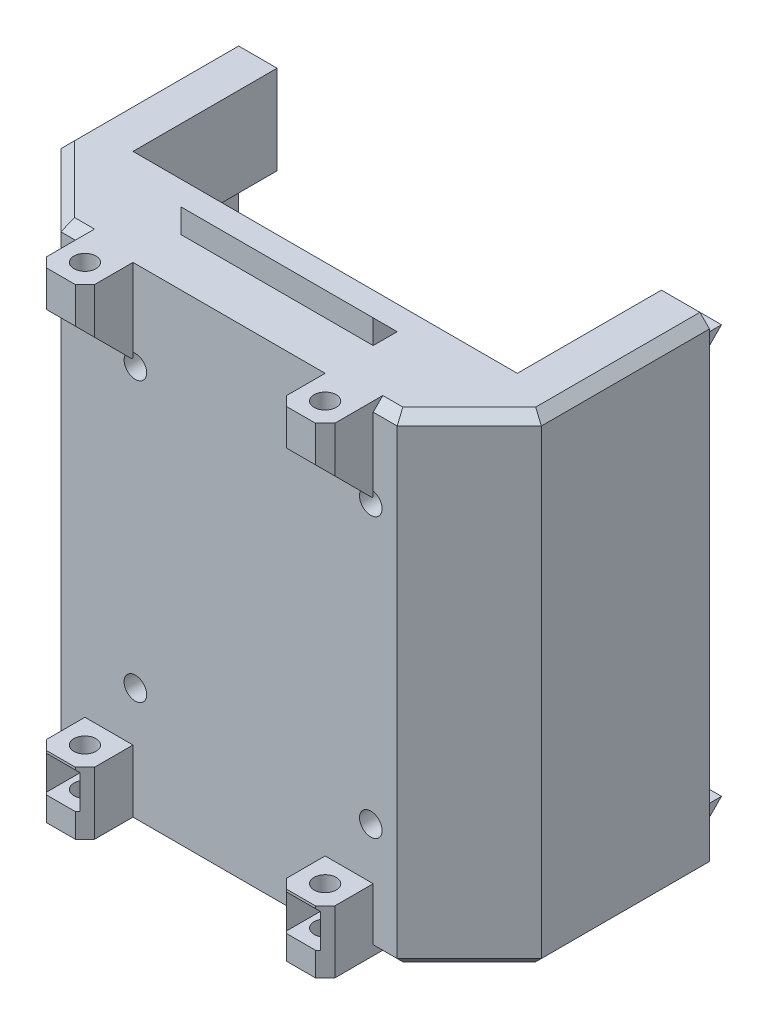
from build123d import *

# Parameters (mm, degrees)
SKETCH1_W               = 100
SKETCH1_H               = 50
BOSS_EXTRUDE1_DEPTH     = 100
CHAMFER1_SIZE           = 15
CUT_EXTRUDE1_REACH      = 124.474
SKETCH2_W               = 80
SKETCH2_H               = 30
SKETCH3_W               = 10
SKETCH3_H               = 10
SKETCH3_R               = 2.3
BOSS_EXTRUDE2_DEPTH     = 7.5
BOSS_EXTRUDE3_START     = -87
SKETCH3_2_W             = 10
SKETCH3_2_H             = 10
SKETCH3_2_R             = 2.3
BOSS_EXTRUDE3_DEPTH     = 13
SKETCH4_W               = 7
SKETCH4_H               = 3.5
CUT_EXTRUDE2_DEPTH      = 9
CHAMFER2_SIZE           = 4
CHAMFER3_SIZE           = 10
CUT_EXTRUDE3_REACH      = 131.474
CUT_EXTRUDE3_START      = -7
SKETCH5_R               = 3.55
SKETCH6_W               = 40
SKETCH6_H               = 5
BOSS_EXTRUDE4_DEPTH     = 5
CHAMFER4_SIZE           = 5
CUT_EXTRUDE4_START      = -100
SKETCH6_2_W             = 40
SKETCH6_2_H             = 5
CUT_EXTRUDE4_DEPTH      = 5
CHAMFER5_SIZE           = 4.75
SKETCH7_W               = 5
SKETCH7_H               = 5
CUT_EXTRUDE5_DEPTH      = 5
SKETCH8_W               = 5
SKETCH8_H               = 5
BOSS_EXTRUDE5_DEPTH     = 5
CHAMFER6_SIZE           = 5
CHAMFER7_SIZE           = 4.75
CHAMFER8_SIZE           = 2
CHAMFER9_SIZE           = 2
CUT_EXTRUDE6_REACH      = 123.45
SKETCH9_R               = 1.35
CUT_EXTRUDE7_DEPTH      = 30
CUT_EXTRUDE_THIN1_START = -15
SKETCH9_2_R             = 2.35
SKETCH9_2_R_2           = 1.35
CUT_EXTRUDE_THIN1_DEPTH = 5


# Some blends are built 0.0001 mm under size
with BuildPart() as part:
    # Sketch1 → Boss-Extrude1 (new body)
    with BuildSketch(Plane(origin=(0, 0, 0), x_dir=(1, 0, 0), z_dir=(0, 1, 0))):
        with Locations((0, 25)):
            Rectangle(SKETCH1_W, SKETCH1_H)
    extrude(amount=BOSS_EXTRUDE1_DEPTH)

    # Chamfer1
    chamfer1_edges = [part.edges().sort_by_distance(p)[0] for p in [
        (50, 50, 0),
        (-50, 50, 0),
    ]]
    chamfer(chamfer1_edges, length=CHAMFER1_SIZE)

    # Sketch2 → Cut-Extrude1 (cut, up to next)
    with BuildSketch(Plane(origin=(0, 100, 0), x_dir=(1, 0, 0), z_dir=(0, 1, 0)), mode=Mode.PRIVATE) as cut_extrude1_sk1:
        with Locations((0, 35)):
            Rectangle(SKETCH2_W, SKETCH2_H)
    cut_extrude1_tool1 = extrude(cut_extrude1_sk1.sketch, amount=-CUT_EXTRUDE1_REACH, mode=Mode.PRIVATE) & part.part
    add(cut_extrude1_tool1.solids().sort_by_distance((0, 100, -35))[0], mode=Mode.SUBTRACT)

    # Sketch3 → Boss-Extrude2 (add)
    # profile 1 of 2: a face of its own
    with BuildSketch(Plane(origin=(0, 100, 0), x_dir=(1, 0, 0), z_dir=(0, 1, 0))):
        with Locations((25, -5)):
            Rectangle(SKETCH3_W, SKETCH3_H)
        with Locations(Location((25, -5, 0), (0, 0, 270))):
            Circle(SKETCH3_R, mode=Mode.SUBTRACT)
    # profile 2 of 2: a face of its own
    with BuildSketch(Plane(origin=(0, 100, 0), x_dir=(1, 0, 0), z_dir=(0, 1, 0))):
        with Locations((-25, -5)):
            Rectangle(SKETCH3_W, SKETCH3_H)
        with Locations(Location((-25, -5, 0), (0, 0, 270))):
            Circle(SKETCH3_R, mode=Mode.SUBTRACT)
    extrude(amount=-BOSS_EXTRUDE2_DEPTH)

    # Sketch3<2> → Boss-Extrude3 (add)
    # profile 1 of 2: a face of its own
    with BuildSketch(Plane(origin=(0, 100, 0), x_dir=(1, 0, 0), z_dir=(0, 1, 0)).offset(BOSS_EXTRUDE3_START)):
        with Locations((25, -5)):
            Rectangle(SKETCH3_2_W, SKETCH3_2_H)
        with Locations(Location((25, -5, 0), (0, 0, 270))):
            Circle(SKETCH3_2_R, mode=Mode.SUBTRACT)
    # profile 2 of 2: a face of its own
    with BuildSketch(Plane(origin=(0, 100, 0), x_dir=(1, 0, 0), z_dir=(0, 1, 0)).offset(BOSS_EXTRUDE3_START)):
        with Locations((-25, -5)):
            Rectangle(SKETCH3_2_W, SKETCH3_2_H)
        with Locations(Location((-25, -5, 0), (0, 0, 270))):
            Circle(SKETCH3_2_R, mode=Mode.SUBTRACT)
    extrude(amount=-BOSS_EXTRUDE3_DEPTH)

    # Sketch4 → Cut-Extrude2 (cut)
    with BuildSketch(Plane.XY.offset(10)):
        with Locations((25, 6.75)):
            Rectangle(SKETCH4_W, SKETCH4_H)
        with Locations((-25, 6.75)):
            Rectangle(SKETCH4_W, SKETCH4_H)
    extrude(amount=-CUT_EXTRUDE2_DEPTH, mode=Mode.SUBTRACT)

    # Chamfer2
    # the kernel refuses this chamfer: 4 mm, written as the material it takes off along each edge
    with BuildSketch(Plane(origin=(28.5, 8.5, 10), x_dir=(0, 0.9996219169112968, 0.02749587661058735), z_dir=(-1, 0, 0)), Plane(origin=(-21.5, 8.5, 10), x_dir=(0, 0.9996219169112968, 0.027495876610588214), z_dir=(-1, 0, 0))) as chamfer2_piece_1:
        Polygon((CHAMFER2_SIZE * 0.999621916911, CHAMFER2_SIZE * 0.0274958766106), (-CHAMFER2_SIZE * 0.0274958766106, CHAMFER2_SIZE * 0.999621916911), (0, 0), align=None)
    extrude(amount=7, mode=Mode.SUBTRACT)

    # Chamfer3
    # the kernel refuses this chamfer: 10 mm, written as the material it adds along each edge
    with BuildSketch(Plane(origin=(30, 92.5, 0), x_dir=(0, -0.9996219169112968, -0.027495876610587645), z_dir=(-1, 0, 0))) as chamfer3_piece_1_section:
        Polygon((CHAMFER3_SIZE * 0.999621916911, CHAMFER3_SIZE * 0.0274958766106), (-CHAMFER3_SIZE * 0.0274958766106, CHAMFER3_SIZE * 0.999621916911), (0, 0), align=None)
    chamfer3_piece_1 = extrude(amount=10, mode=Mode.PRIVATE)
    chamfer3_piece_1 = split(chamfer3_piece_1, bisect_by=Plane(origin=(28.657738018, 91.498258794, 10), z_dir=(0, 0, -1)), keep=Keep.TOP, mode=Mode.PRIVATE)
    chamfer3_piece_1 = chamfer3_piece_1 - Plane(origin=(25, 91.498258794, 5), x_dir=(0, 0, 1), z_dir=(0, 1, 0)) * Cylinder(2.3, 60, mode=Mode.PRIVATE)
    add(chamfer3_piece_1)
    with BuildSketch(Plane(origin=(-30, 92.5, 0), x_dir=(0, -0.9996219169112968, -0.02749587661058646), z_dir=(1, 0, 0))) as chamfer3_piece_2_section:
        Polygon((CHAMFER3_SIZE * 0.999621916911, -CHAMFER3_SIZE * 0.0274958766106), (-CHAMFER3_SIZE * 0.0274958766106, -CHAMFER3_SIZE * 0.999621916911), (0, 0), align=None)
    chamfer3_piece_2 = extrude(amount=10, mode=Mode.PRIVATE)
    chamfer3_piece_2 = split(chamfer3_piece_2, bisect_by=Plane(origin=(-28.657738018, 91.498258794, 10), z_dir=(0, 0, -1)), keep=Keep.TOP, mode=Mode.PRIVATE)
    chamfer3_piece_2 = chamfer3_piece_2 - Plane(origin=(-25, 91.498258794, 5), x_dir=(0, 0, 1), z_dir=(0, 1, 0)) * Cylinder(2.3, 60, mode=Mode.PRIVATE)
    add(chamfer3_piece_2)

    # Cut-Extrude3: up to this plane
    cut_extrude3_end = Plane(origin=(-50, 82.5, 0), z_dir=(0, -0.707106781186547, 0.707106781186548))
    # Sketch5 → Cut-Extrude3 (cut, up to the surface)
    with BuildSketch(Plane(origin=(0, 100, 0), x_dir=(1, 0, 0), z_dir=(0, 1, 0)).offset(CUT_EXTRUDE3_START), mode=Mode.PRIVATE) as cut_extrude3_sk1:
        with Locations(Location((-25, -5, 0), (0, 0, 270))):
            Circle(SKETCH5_R)
    cut_extrude3_tool1 = split(extrude(cut_extrude3_sk1.sketch, amount=-CUT_EXTRUDE3_REACH, mode=Mode.PRIVATE), bisect_by=cut_extrude3_end, keep=Keep.BOTH, mode=Mode.PRIVATE)
    add(cut_extrude3_tool1.solids().sort_by_distance((-25, 93, 5))[0], mode=Mode.SUBTRACT)
    # Sketch5 → Cut-Extrude3 (cut, up to the surface)
    with BuildSketch(Plane(origin=(0, 100, 0), x_dir=(1, 0, 0), z_dir=(0, 1, 0)).offset(CUT_EXTRUDE3_START), mode=Mode.PRIVATE) as cut_extrude3_sk2:
        with Locations(Location((25, -5, 0), (0, 0, 270))):
            Circle(SKETCH5_R)
    cut_extrude3_tool2 = split(extrude(cut_extrude3_sk2.sketch, amount=-CUT_EXTRUDE3_REACH, mode=Mode.PRIVATE), bisect_by=cut_extrude3_end, keep=Keep.BOTH, mode=Mode.PRIVATE)
    add(cut_extrude3_tool2.solids().sort_by_distance((25, 93, 5))[0], mode=Mode.SUBTRACT)

    # Sketch6 → Boss-Extrude4 (add)
    with BuildSketch(Plane(origin=(0, 100, 0), x_dir=(1, 0, 0), z_dir=(0, 1, 0))):
        with Locations((0, 12.5)):
            Rectangle(SKETCH6_W, SKETCH6_H)
    extrude(amount=BOSS_EXTRUDE4_DEPTH)

    # Chamfer4
    chamfer4_edges = [part.edges().sort_by_distance(p)[0] for p in [
        (0, 105, -15),
    ]]
    chamfer(chamfer4_edges, length=CHAMFER4_SIZE - 0.0001)  # a hair under: the kernel refuses the full size

    # Sketch6<2> → Cut-Extrude4 (cut)
    with BuildSketch(Plane(origin=(0, 100, 0), x_dir=(1, 0, 0), z_dir=(0, 1, 0)).offset(CUT_EXTRUDE4_START)):
        with Locations((0, 12.5)):
            Rectangle(SKETCH6_2_W, SKETCH6_2_H)
    extrude(amount=CUT_EXTRUDE4_DEPTH, mode=Mode.SUBTRACT)

    # Chamfer5
    chamfer5_edges = [part.edges().sort_by_distance(p)[0] for p in [
        (0, 5, -15),
    ]]
    chamfer(chamfer5_edges, length=CHAMFER5_SIZE)

    # Sketch7 → Cut-Extrude5 (cut)
    with BuildSketch(Plane(origin=(0, 0, -50), x_dir=(-1, 0, 0), z_dir=(0, 0, -1))):
        with Locations((45, 7.5)):
            Rectangle(SKETCH7_W, SKETCH7_H)
        with Locations((45, 92.5)):
            Rectangle(SKETCH7_W, SKETCH7_H)
    extrude(amount=-CUT_EXTRUDE5_DEPTH, mode=Mode.SUBTRACT)

    # Sketch8 → Boss-Extrude5 (add)
    with BuildSketch(Plane(origin=(0, 0, -50), x_dir=(-1, 0, 0), z_dir=(0, 0, -1))):
        with Locations((-45, 92.5)):
            Rectangle(SKETCH8_W, SKETCH8_H)
        with Locations((-45, 7.5)):
            Rectangle(SKETCH8_W, SKETCH8_H)
    extrude(amount=BOSS_EXTRUDE5_DEPTH)

    # Chamfer6
    chamfer6_edges = [part.edges().sort_by_distance(p)[0] for p in [
        (45, 5, -55),
        (45, 90, -55),
    ]]
    chamfer(chamfer6_edges, length=CHAMFER6_SIZE - 0.0001)  # a hair under: the kernel refuses the full size

    # Chamfer7
    chamfer7_edges = [part.edges().sort_by_distance(p)[0] for p in [
        (-45, 5, -45),
        (-45, 90, -45),
    ]]
    chamfer(chamfer7_edges, length=CHAMFER7_SIZE)

    # Chamfer8
    # the kernel refuses this chamfer: 2 mm, written as the material it takes off along each edge
    with BuildSketch(Plane(origin=(30, 18.143365976, 10), x_dir=(-0.9996219169112968, 0, 0.02749587661058651), z_dir=(0, -1, 0)), Plane(origin=(20, 18.143365976, 10), x_dir=(-0.027495876610585623, 0, -0.9996219169112968), z_dir=(0, -1, 0)), Plane(origin=(-30, 18.143365976, 10), x_dir=(-0.027495876610585623, 0, -0.9996219169112968), z_dir=(0, -1, 0)), Plane(origin=(-20, 18.143365976, 10), x_dir=(-0.9996219169112968, 0, 0.02749587661058651), z_dir=(0, -1, 0))) as chamfer8_piece_1:
        Polygon((CHAMFER8_SIZE * 0.999621916911, CHAMFER8_SIZE * 0.0274958766106), (-CHAMFER8_SIZE * 0.0274958766106, CHAMFER8_SIZE * 0.999621916911), (0, 0), align=None)
    extrude(amount=23.286731952, mode=Mode.SUBTRACT)
    with BuildSketch(Plane(origin=(-30, 105.143365976, 10), x_dir=(-0.027495876610585647, 0, -0.9996219169112968), z_dir=(0, -1, 0)), Plane(origin=(-20, 105.143365976, 10), x_dir=(-0.9996219169112968, 0, 0.02749587661058651), z_dir=(0, -1, 0)), Plane(origin=(20, 105.143365976, 10), x_dir=(-0.027495876610585623, 0, -0.9996219169112968), z_dir=(0, -1, 0)), Plane(origin=(30, 105.143365976, 10), x_dir=(-0.9996219169112968, 0, 0.02749587661058651), z_dir=(0, -1, 0))) as chamfer8_piece_2:
        Polygon((CHAMFER8_SIZE * 0.999621916911, CHAMFER8_SIZE * 0.0274958766106), (-CHAMFER8_SIZE * 0.0274958766106, CHAMFER8_SIZE * 0.999621916911), (0, 0), align=None)
    extrude(amount=17.786731952, mode=Mode.SUBTRACT)

    # Chamfer9
    chamfer9_edges = [part.edges().sort_by_distance(p)[0] for p in [
        (-50, 100, -32.5),
        (-32.5, 0, 0),
        (-32.5, 100, 0),
        (50, 0, -32.5),
        (42.5, 0, -7.5),
        (-42.5, 0, -7.5),
        (50, 100, -32.5),
        (42.5, 100, -7.5),
        (-42.5, 100, -7.5),
        (32.5, 100, 0),
        (-50, 0, -32.5),
        (32.5, 0, 0),
    ]]
    chamfer(chamfer9_edges, length=CHAMFER9_SIZE)

    # Sketch9 → Cut-Extrude6 (cut, up to next)
    with BuildSketch(Plane(origin=(0, 0, -20), x_dir=(-1, 0, 0), z_dir=(0, 0, -1)), mode=Mode.PRIVATE) as cut_extrude6_sk1:
        with Locations((-29.5, 81.5)):
            Circle(SKETCH9_R)
    cut_extrude6_tool1 = extrude(cut_extrude6_sk1.sketch, amount=-CUT_EXTRUDE6_REACH, mode=Mode.PRIVATE) & part.part
    # Sketch9 → Cut-Extrude6 (cut, up to next)
    with BuildSketch(Plane(origin=(0, 0, -20), x_dir=(-1, 0, 0), z_dir=(0, 0, -1)), mode=Mode.PRIVATE) as cut_extrude6_sk2:
        with Locations((19.5, 81.5)):
            Circle(SKETCH9_R)
    cut_extrude6_tool2 = extrude(cut_extrude6_sk2.sketch, amount=-CUT_EXTRUDE6_REACH, mode=Mode.PRIVATE) & part.part
    # Sketch9 → Cut-Extrude6 (cut, up to next)
    with BuildSketch(Plane(origin=(0, 0, -20), x_dir=(-1, 0, 0), z_dir=(0, 0, -1)), mode=Mode.PRIVATE) as cut_extrude6_sk3:
        with Locations((19.5, 23.5)):
            Circle(SKETCH9_R)
    cut_extrude6_tool3 = extrude(cut_extrude6_sk3.sketch, amount=-CUT_EXTRUDE6_REACH, mode=Mode.PRIVATE) & part.part
    # Sketch9 → Cut-Extrude6 (cut, up to next)
    with BuildSketch(Plane(origin=(0, 0, -20), x_dir=(-1, 0, 0), z_dir=(0, 0, -1)), mode=Mode.PRIVATE) as cut_extrude6_sk4:
        with Locations((-29.5, 23.5)):
            Circle(SKETCH9_R)
    cut_extrude6_tool4 = extrude(cut_extrude6_sk4.sketch, amount=-CUT_EXTRUDE6_REACH, mode=Mode.PRIVATE) & part.part
    add(cut_extrude6_tool1.solids().sort_by_distance((29.5, 81.5, -20))[0], mode=Mode.SUBTRACT)
    add(cut_extrude6_tool2.solids().sort_by_distance((-19.5, 81.5, -20))[0], mode=Mode.SUBTRACT)
    add(cut_extrude6_tool3.solids().sort_by_distance((-19.5, 23.5, -20))[0], mode=Mode.SUBTRACT)
    add(cut_extrude6_tool4.solids().sort_by_distance((29.5, 23.5, -20))[0], mode=Mode.SUBTRACT)

    # Sketch10 → Cut-Extrude7 (cut)
    with BuildSketch(Plane(origin=(0, 0, -50), x_dir=(-1, 0, 0), z_dir=(0, 0, -1))):
        Polygon((40, 81.5), (48, 73.5), (48, 31.5), (40, 23.5), align=None)
    extrude(amount=-CUT_EXTRUDE7_DEPTH, mode=Mode.SUBTRACT)

    # Sketch9<2> → Cut-Extrude-Thin1 (cut)
    # profile 1 of 4: a face of its own
    with BuildSketch(Plane(origin=(0, 0, -20), x_dir=(-1, 0, 0), z_dir=(0, 0, -1)).offset(CUT_EXTRUDE_THIN1_START)):
        with Locations((-29.5, 81.5)):
            Circle(SKETCH9_2_R)
        with Locations((-29.5, 81.5)):
            Circle(SKETCH9_2_R_2, mode=Mode.SUBTRACT)
    # profile 2 of 4: a face of its own
    with BuildSketch(Plane(origin=(0, 0, -20), x_dir=(-1, 0, 0), z_dir=(0, 0, -1)).offset(CUT_EXTRUDE_THIN1_START)):
        with Locations((19.5, 81.5)):
            Circle(SKETCH9_2_R)
        with Locations((19.5, 81.5)):
            Circle(SKETCH9_2_R_2, mode=Mode.SUBTRACT)
    # profile 3 of 4: a face of its own
    with BuildSketch(Plane(origin=(0, 0, -20), x_dir=(-1, 0, 0), z_dir=(0, 0, -1)).offset(CUT_EXTRUDE_THIN1_START)):
        with Locations((19.5, 23.5)):
            Circle(SKETCH9_2_R)
        with Locations((19.5, 23.5)):
            Circle(SKETCH9_2_R_2, mode=Mode.SUBTRACT)
    # profile 4 of 4: a face of its own
    with BuildSketch(Plane(origin=(0, 0, -20), x_dir=(-1, 0, 0), z_dir=(0, 0, -1)).offset(CUT_EXTRUDE_THIN1_START)):
        with Locations((-29.5, 23.5)):
            Circle(SKETCH9_2_R)
        with Locations((-29.5, 23.5)):
            Circle(SKETCH9_2_R_2, mode=Mode.SUBTRACT)
    extrude(amount=-CUT_EXTRUDE_THIN1_DEPTH, mode=Mode.SUBTRACT)


solid = part.part
